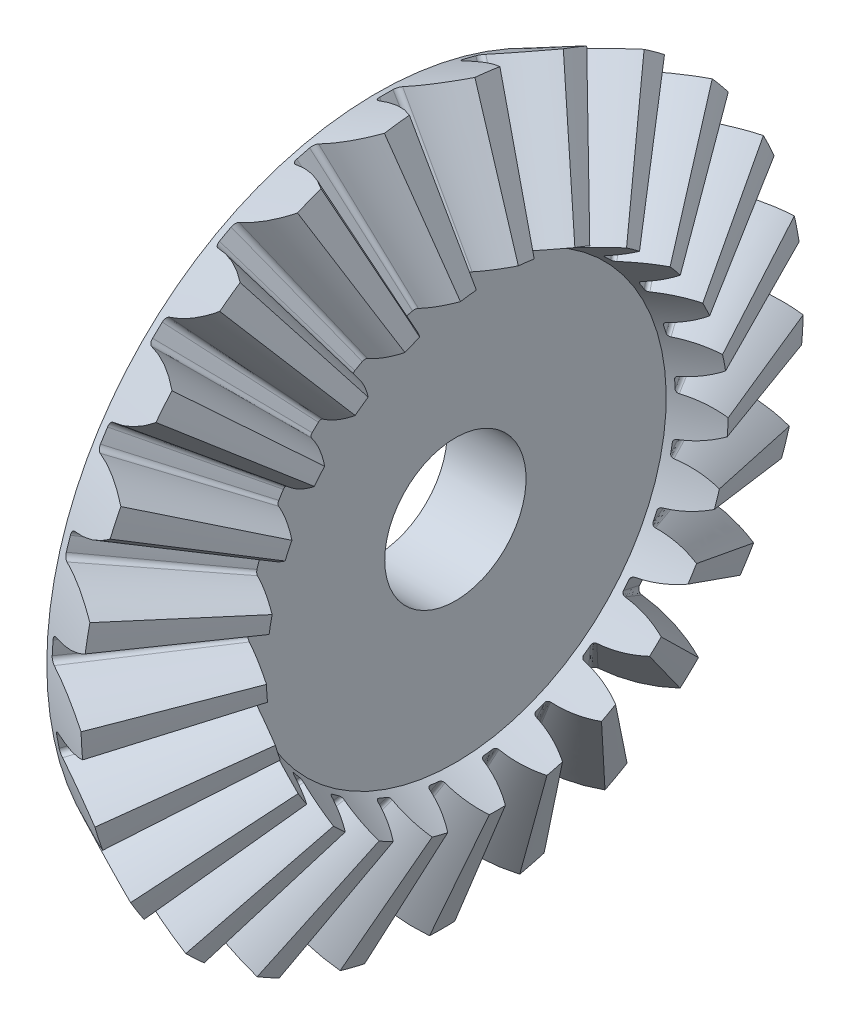
from build123d import *

# Parameters (mm, degrees)
TEETHCUTS_COUNT = 25
TEETHCUTS_ANGLE = 345.6
HUBSKE_R        = 7.5
HUB_DEPTH       = 0.0001016
BORSKE_R        = 2.5
BORE_DEPTH      = 7.738881428


with BuildPart() as part:
    # BasProSke → Base-Revolve (revolve)
    with BuildSketch(Plane(origin=(0, 0, 0), x_dir=(1, 0, 0), z_dir=(0, 1, 0)), mode=Mode.PRIVATE) as base_revolve_sk:
        Polygon((0, 0), (0, 11.665361301), (2.3212001, 12.779537345), (4.274847629, 8.17111831), (2.790693694, 7.458724424), (2.790693694, 0), align=None)
    revolve(base_revolve_sk.sketch.rotate(Axis((-10, 0, 0), (1, 0, 0)), 180), axis=Axis((-10, 0, 0), (1, 0, 0)))

    # ToothCut: read off the stored shape, not the designer's step
    # ToothCut: loft between two sections, ruled curve by curve
    toothcut_from = [
        Edge.make_bspline([(7.747528503, 0.00417498, -0.008258704), (7.741996161, 0.001519455, -0.015427684), (7.733515238, -0.002551388, -0.014682648), (7.729069189, -0.004685491, -0.006637081)], [0, 0, 0, 0, 1, 1, 1, 1], 3, [1, 0.725523009, 0.725523009, 1]),
        Edge.make_bspline([(7.729069189, -0.004685491, 0.006637081), (7.733515238, -0.002551388, 0.014682648), (7.741996161, 0.001519455, 0.015427684), (7.747528503, 0.00417498, 0.008258704)], [0, 0, 0, 0, 1, 1, 1, 1], 3, [1, 0.725523009, 0.725523009, 1]),
        Edge.make_bspline([(7.729069189, -0.004685491, -0.006637081), (7.72850377, -0.004956892, -0.0056139), (7.728073864, -0.005163247, -0.004512603), (7.727788037, -0.005300444, -0.003355132)], [0, 0, 0, 0, 1, 1, 1, 1], 3, [1, 0.993358373, 0.993358373, 1]),
        Edge.make_bspline([(7.727788037, -0.005300444, 0.003355132), (7.728073864, -0.005163247, 0.004512603), (7.72850377, -0.004956892, 0.0056139), (7.729069189, -0.004685491, 0.006637081)], [0, 0, 0, 0, 1, 1, 1, 1], 3, [1, 0.993358373, 0.993358373, 1]),
        Edge.make_bspline([(7.727788037, -0.005300444, -0.003355132), (7.727242391, -0.005562354, -0.001145509), (7.727242391, -0.005562354, 0.001145509), (7.727788037, -0.005300444, 0.003355132)], [0, 0, 0, 0, 1, 1, 1, 1], 3, [1, 0.976314929, 0.976314929, 1]),
        Edge.make_line((7.747528503, 0.00417498, 0.008258704), (7.747528503, 0.00417498, -0.008258704)),
    ]
    toothcut_to = [
        Edge.make_bspline([(2.500380689, 12.865544028, -1.310224051), (1.902664435, 12.578640227, -0.837306236), (1.220213466, 12.251063763, -0.53699955), (0.492776131, 11.901893843, -0.426794914)], [0, 0, 0, 0, 1, 1, 1, 1], 3, [1, 0.980585492, 0.980585492, 1]),
        Edge.make_bspline([(0.492776131, 11.901893843, 0.426794914), (1.220213466, 12.251063763, 0.53699955), (1.902664435, 12.578640227, 0.837306236), (2.500380689, 12.865544028, 1.310224051)], [0, 0, 0, 0, 1, 1, 1, 1], 3, [1, 0.980585492, 0.980585492, 1]),
        Edge.make_bspline([(0.492776131, 11.901893843, -0.426794914), (0.402619638, 11.858618727, -0.413136468), (0.34352932, 11.830255374, -0.336381425), (0.345484821, 11.831194014, -0.235471678)], [0, 0, 0, 0, 1, 1, 1, 1], 3, [1, 0.83088237, 0.83088237, 1]),
        Edge.make_bspline([(0.345484821, 11.831194014, 0.235471678), (0.34352932, 11.830255374, 0.336381425), (0.402619638, 11.858618727, 0.413136468), (0.492776131, 11.901893843, 0.426794914)], [0, 0, 0, 0, 1, 1, 1, 1], 3, [1, 0.83088237, 0.83088237, 1]),
        Edge.make_bspline([(0.345484821, 11.831194014, -0.235471678), (0.348526678, 11.832654106, -0.078502646), (0.348526678, 11.832654106, 0.078502646), (0.345484821, 11.831194014, 0.235471678)], [0, 0, 0, 0, 1, 1, 1, 1], 3, [1, 0.999846034, 0.999846034, 1]),
        Edge.make_line((2.500380689, 12.865544028, 1.310224051), (2.500380689, 12.865544028, -1.310224051)),
    ]
    toothcut = Solid(Shell([*[Face.make_surface_from_curves(toothcut_from[k], toothcut_to[k]) for k in range(6)], Face(Wire(toothcut_from)), Face(Wire(toothcut_to))]))
    add(toothcut, mode=Mode.SUBTRACT)

    # TeethCuts: ToothCut ×25 about axis
    teethcuts_axis = Axis((-10, 0, 0), (1, 0, 0))
    for i in range(1, TEETHCUTS_COUNT):
        add(toothcut.rotate(teethcuts_axis, i * TEETHCUTS_ANGLE / (TEETHCUTS_COUNT - 1)), mode=Mode.SUBTRACT)

    # HubSke → Hub (add)
    with BuildSketch(Plane.ZY):
        with Locations(Location((0, 0, 0), (0, 0, 180))):
            Circle(HUBSKE_R)
    extrude(amount=HUB_DEPTH)

    # BorSke → Bore (cut, symmetric)
    with BuildSketch(Plane(origin=(0, 0, 0), x_dir=(0, 0, -1), z_dir=(1, 0, 0))):
        with Locations(Location((0, 0, 0), (0, 0, 180))):
            Circle(BORSKE_R)
    extrude(amount=BORE_DEPTH, both=True, mode=Mode.SUBTRACT)


solid = part.part
